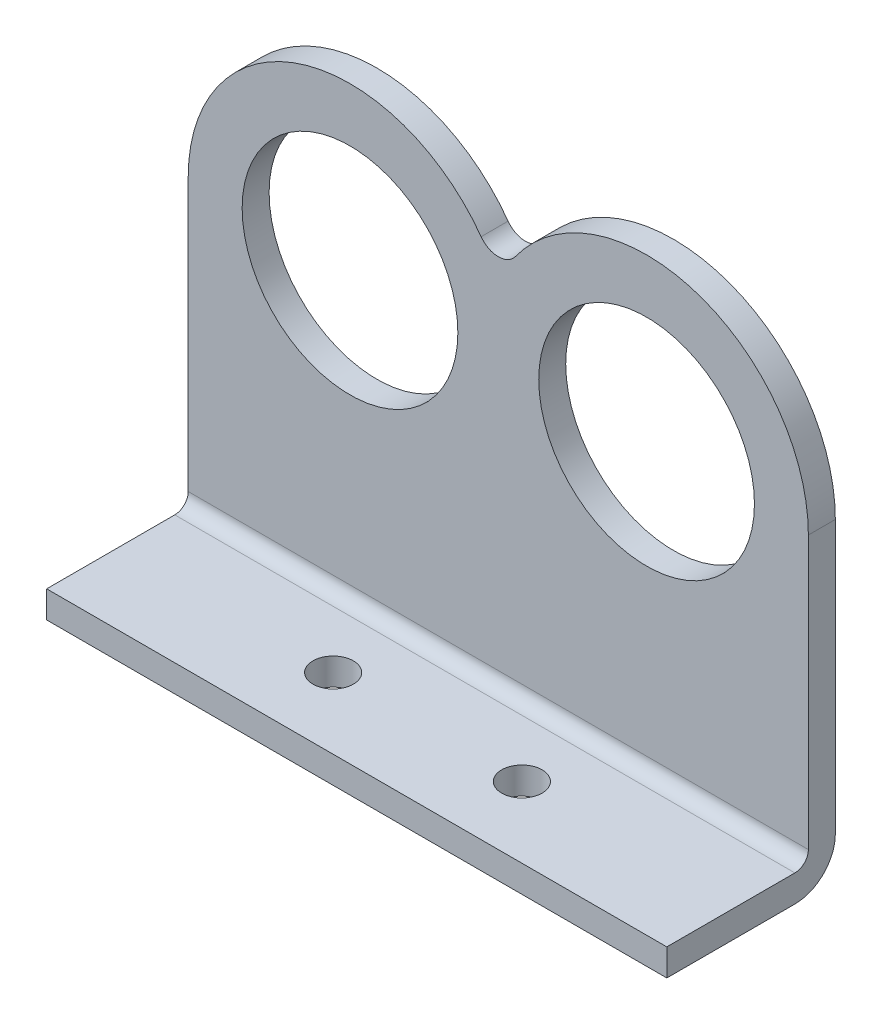
from build123d import *

# Parameters (mm, degrees)
SKETCH1_W               = 23
SKETCH1_H               = 12.5
BOSS_EXTRUDE1_DEPTH     = 2
SKETCH2_W               = 23
SKETCH2_H               = 33.206230298
BOSS_EXTRUDE2_DEPTH     = 2
SKETCH3_R               = 1.5
CUT_EXTRUDE1_DEPTH      = 2
SKETCH4_R               = 8
CUT_EXTRUDE2_DEPTH      = 2
CUT_EXTRUDE3_DEPTH      = 44.871729528
CUT_EXTRUDE3_DEPTH_BACK = 2
FILLET1_R               = 3
FILLET2_R               = 1


with BuildPart() as part:
    # Sketch1 → Boss-Extrude1 (new body)
    with BuildSketch(Plane(origin=(0, 0, 0), x_dir=(1, 0, 0), z_dir=(0, 1, 0))):
        with Locations((11.5, 6.25)):
            Rectangle(SKETCH1_W, SKETCH1_H)
    extrude(amount=BOSS_EXTRUDE1_DEPTH)

    # Sketch2 → Boss-Extrude2 (add)
    with BuildSketch(Plane(origin=(0, 0, -12.5), x_dir=(-1, 0, 0), z_dir=(0, 0, -1))):
        with Locations((-11.5, 18.603115149)):
            Rectangle(SKETCH2_W, SKETCH2_H)
    extrude(amount=-BOSS_EXTRUDE2_DEPTH)

    # Sketch3 → Cut-Extrude1 (cut)
    with BuildSketch(Plane(origin=(0, 2, 0), x_dir=(1, 0, 0), z_dir=(0, 1, 0))):
        with Locations((7, 5.25)):
            Circle(SKETCH3_R)
    extrude(amount=-CUT_EXTRUDE1_DEPTH, mode=Mode.SUBTRACT)

    # Sketch4 → Cut-Extrude2 (cut)
    with BuildSketch(Plane(origin=(0, 0, -12.5), x_dir=(-1, 0, 0), z_dir=(0, 0, -1))):
        with Locations((-11, 23.206230298)):
            Circle(SKETCH4_R)
    extrude(amount=-CUT_EXTRUDE2_DEPTH, mode=Mode.SUBTRACT)

    # Sketch6 → Cut-Extrude3 (cut, two sides: drawn at the far end of the back side and taken through both)
    with BuildSketch(Plane(origin=(0, 0, -12.5), x_dir=(-1, 0, 0), z_dir=(0, 0, -1)).offset(-CUT_EXTRUDE3_DEPTH_BACK)):
        with BuildLine():
            Line((-23, -61.737420213), (-23, 23.206230298))
            ThreePointArc((-23, 23.206230298), (-14.692788513, 34.623905762), (-1.272781167, 30.233407097))
            ThreePointArc((-1.272781167, 30.233407097), (-0.714730292, 29.754828233), (0, 29.582726176))
            Line((0, 29.582726176), (84.943650511, 29.582726176))
            Line((84.943650511, 29.582726176), (-24.781977419, 159.282308379))
            Line((-24.781977419, 159.282308379), (-132.72562793, 67.962161991))
            Line((-132.72562793, 67.962161991), (-23, -61.737420213))
        make_face()
    extrude(amount=CUT_EXTRUDE3_DEPTH + CUT_EXTRUDE3_DEPTH_BACK, mode=Mode.SUBTRACT)

    # Fillet1
    fillet1_edges = [part.edges().sort_by_distance(p)[0] for p in [
        (11.5, 0, -12.5),
    ]]
    fillet(fillet1_edges, radius=FILLET1_R)

    # Fillet2
    fillet2_edges = [part.edges().sort_by_distance(p)[0] for p in [
        (11.5, 2, -10.5),
    ]]
    fillet(fillet2_edges, radius=FILLET2_R)

    # Mirror1: part across plane


with BuildPart() as part_1:
    add(part.part)
    add(part.part.mirror(Plane(origin=(0, 0, 0), x_dir=(0, 0, 1), z_dir=(1, 0, 0))))


solid = part_1.part
